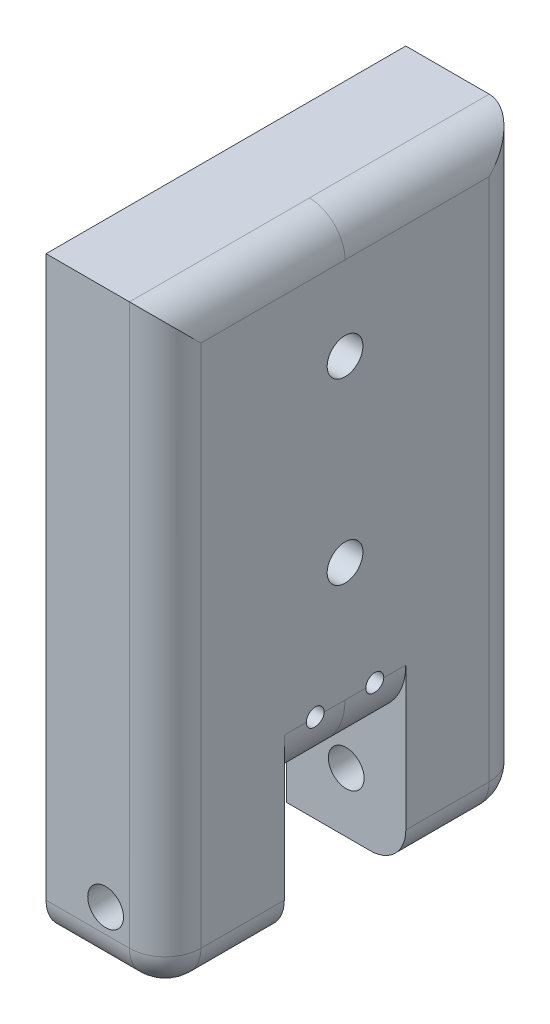
from build123d import *

# Parameters (mm, degrees)
SKETCH1_R           = 0.75
BOSS_EXTRUDE1_DEPTH = 10
FILLET1_R           = 3
FILLET2_R           = 5
SKETCH2_R           = 1.5
CUT_EXTRUDE1_DEPTH  = 10


# Read off the part's stored shape, not the designer's step: Mirror10
with BuildPart() as part:
    # Sketch1 → Boss-Extrude1 (new body)
    with BuildSketch(Plane(origin=(0, 0, 0), x_dir=(0, 0, -1), z_dir=(1, 0, 0))):
        with BuildLine():
            Line((5.15, 0), (15.15, 0))
            Line((15.15, 0), (15.15, 50))
            Line((15.15, 50), (0.05, 50))
            Line((0.05, 50), (0.05, 41.5))
            ThreePointArc((0.05, 41.5), (1.55, 40), (0.05, 38.5))
            Line((0.05, 38.5), (0.05, 26.5))
            ThreePointArc((0.05, 26.5), (1.55, 25), (0.05, 23.5))
            Line((0.05, 23.5), (0.05, 10))
            Line((0.05, 10), (5.15, 10))
            Line((5.15, 10), (5.15, 0))
        make_face()
        with Locations((2.55, 15)):
            Circle(SKETCH1_R, mode=Mode.SUBTRACT)
    extrude(amount=BOSS_EXTRUDE1_DEPTH)

    # Fillet1
    fillet1_edges = [part.edges().sort_by_distance(p)[0] for p in [
        (5, 0, -15.15),
        (10, 0, -10.15),
        (10, 25, -15.15),
        (10, 50, -7.6),
    ]]
    fillet(fillet1_edges, radius=FILLET1_R)

    # Fillet2
    # the kernel refuses this fillet: 5 mm, written as the material it takes off along each edge
    with BuildSketch(Plane(origin=(0, 10, 12.45), x_dir=(0, 1, 0), z_dir=(0, 0, -1))) as fillet2_piece_1:
        with BuildLine():
            CenterArc((FILLET2_R, FILLET2_R), FILLET2_R, 180, 90)
            Line((0, FILLET2_R), (0, 0))
            Line((0, 0), (FILLET2_R, 0))
        make_face()
    extrude(amount=17.6, mode=Mode.SUBTRACT)
    with BuildSketch(Plane(origin=(10, 10, 12.45), x_dir=(0, 1, 0), z_dir=(0, 0, -1))) as fillet2_piece_2:
        with BuildLine():
            CenterArc((FILLET2_R, -FILLET2_R), FILLET2_R, 90, 90)
            Line((0, -FILLET2_R), (0, 0))
            Line((0, 0), (FILLET2_R, 0))
        make_face()
    extrude(amount=17.6, mode=Mode.SUBTRACT)

    # Sketch2 → Cut-Extrude1 (cut)
    with BuildSketch(Plane(origin=(0, 0, -15.15), x_dir=(-1, 0, 0), z_dir=(0, 0, -1))):
        with Locations((-5, 5)):
            Circle(SKETCH2_R)
    extrude(amount=-CUT_EXTRUDE1_DEPTH, mode=Mode.SUBTRACT)

    # Mirror10: part across plane


with BuildPart() as part_1:
    add(part.part)
    add(part.part.mirror(Plane(origin=(10, 50, -0.05), x_dir=(1, 0, 0), z_dir=(0, 0, -1))))


solid = part_1.part
